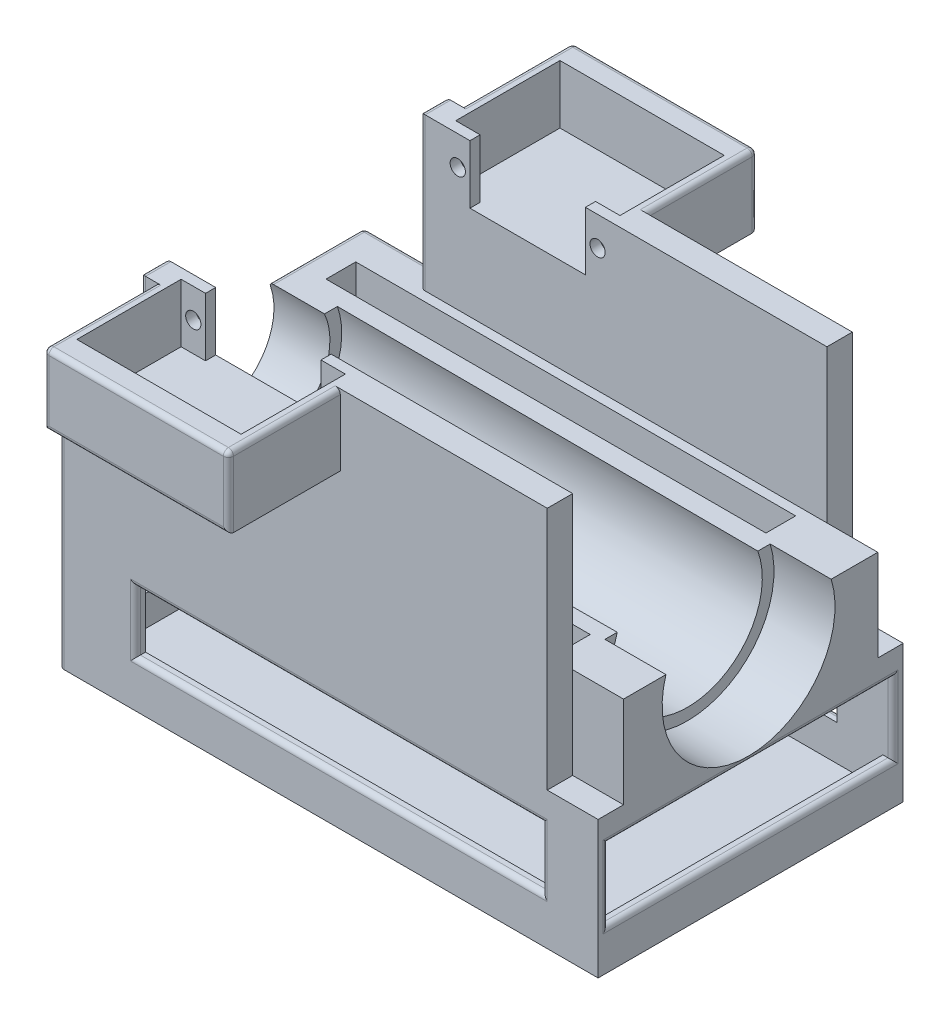
from build123d import *

# Parameters (mm, degrees)
SKETCH_1_W             = 106
SKETCH_1_H             = 60
ARDUINO_DEPTH          = 45
ARDUINO_2_DEPTH        = 102
SKETCH_3_W             = 28
SKETCH_3_H             = 6
ARDUINO_3_DEPTH        = 2
SKETCH_4_W             = 40
SKETCH_4_H             = 12
ARDUINO_4_DEPTH        = 60
ARDUINO_5_DEPTH        = 5
SKETCH_11_W            = 12
SKETCH_11_H            = 17
SKETCH_13_R            = 12.26
CUT_EXTRUDE_2679_DEPTH = 110.42948373
SKETCH_25_W            = 90
SKETCH_25_H            = 5
EXTRUDE_3075_DEPTH     = 30
EXTRUDE_3668_DEPTH     = 22
CUT_EXTRUDE_1_REACH    = 115.751
CUT_EXTRUDE_2_DEPTH    = 17.5
SKETCH_28_W            = 4.8
SKETCH_28_H            = 11.5
SKETCH_28_R            = 1.5
EXTRUDE_4845_DEPTH     = 2
FILLET_1_R             = 1
SKETCH_30_W            = 10
SKETCH_30_H            = 5
CUT_EXTRUDE_2_2_DEPTH  = 48
SKETCH_32_W            = 86.504453115
SKETCH_32_H            = 5.850542723
SKETCH_32_H_2          = 5.850542722
CUT_EXTRUDE_4_DEPTH    = 20


with BuildPart() as part:
    # 草图1 → arduino (new body)
    with BuildSketch(Plane(origin=(0, 0, 0), x_dir=(1, 0, 0), z_dir=(0, 1, 0))):
        with Locations((7.944608655, 0.410719743)):
            Rectangle(SKETCH_1_W, SKETCH_1_H)
    extrude(amount=ARDUINO_DEPTH)

    # 草图2 → arduino 2 (cut)
    with BuildSketch(Plane(origin=(60.944608655, 0, 0), x_dir=(0, 0, -1), z_dir=(1, 0, 0))):
        Polygon((-27.589280257, 22), (28.410719743, 22), (28.410719743, 2), (0.410719743, 2), (-27.589280257, 2), align=None)
    extrude(amount=-ARDUINO_2_DEPTH, mode=Mode.SUBTRACT)

    # 草图3 → arduino 3 (add)
    with BuildSketch(Plane(origin=(60.944608655, 0, 0), x_dir=(0, 0, -1), z_dir=(1, 0, 0))):
        with Locations((14.410719743, 5)):
            Rectangle(SKETCH_3_W, SKETCH_3_H)
        with Locations((-13.589280257, 5)):
            Rectangle(SKETCH_3_W, SKETCH_3_H)
    extrude(amount=-ARDUINO_3_DEPTH)

    # 草图4 → arduino 4 (cut)
    with BuildSketch(Plane(origin=(0, 0, -30.410719743), x_dir=(-1, 0, 0), z_dir=(0, 0, -1))):
        with Locations((10.055391345, 15)):
            Rectangle(SKETCH_4_W, SKETCH_4_H)
        with Locations((-29.944608655, 15)):
            Rectangle(SKETCH_4_W, SKETCH_4_H)
    extrude(amount=-ARDUINO_4_DEPTH, mode=Mode.SUBTRACT)

    # 草图7 → arduino 5 (cut)
    with BuildSketch(Plane.ZY.offset(45.055391345)):
        Polygon((-0.410719743, 22), (-28.410719743, 22), (-28.410719743, 8), (27.589280257, 8), (27.589280257, 22), align=None)
    extrude(amount=-ARDUINO_5_DEPTH, mode=Mode.SUBTRACT)

    # 草图11 → Cut-Revolve 2344 (revolve, cut)
    with BuildSketch(Plane.XY):
        with Locations((54.944608655, 31.5)):
            Rectangle(SKETCH_11_W, SKETCH_11_H)
    revolve(axis=Axis((60.944608655, 40, 0), (-1, 0, 0)), mode=Mode.SUBTRACT)

    # 草图12 → Cut-Revolve 2556 (revolve, cut)
    with BuildSketch(Plane.XY):
        Polygon((48.944608655, 25.3), (48.944608655, 40), (-34.055391345, 40), (-34.055391345, 25), align=None)
    revolve(axis=Axis((48.944608655, 40, 0), (-1, 0, 0)), mode=Mode.SUBTRACT)

    # 草图13 → Cut-Extrude 2679 (cut, through all)
    with BuildSketch(Plane(origin=(-34.055391345, 0, 0), x_dir=(0, 0, -1), z_dir=(1, 0, 0))):
        with Locations((0.410719743, 40)):
            Circle(SKETCH_13_R)
    extrude(amount=-CUT_EXTRUDE_2679_DEPTH, mode=Mode.SUBTRACT)

    # 草图25 → Extrude 3075 (add)
    with BuildSketch(Plane(origin=(0, 45, 0), x_dir=(1, 0, 0), z_dir=(0, 1, 0))):
        with Locations((15.944608655, -27.089280257)):
            Rectangle(SKETCH_25_W, SKETCH_25_H)
    extrude_3075 = extrude(amount=EXTRUDE_3075_DEPTH)

    # 草图26 → Extrude 3668 (add)
    with BuildSketch(Plane.XY.offset(29.589280257)):
        Polygon((10.244608655, 61), (10.244608655, 75), (8.244608655, 75), (8.244608655, 63.5), (-24.055391345, 63.5), (-24.055391345, 75), (-26.055391345, 75), (-26.055391345, 61), align=None)
        Polygon((8.244608655, 63.5), (8.244608655, 75), (-16.055391345, 75), (-24.055391345, 75), (-24.055391345, 63.5), align=None)
    extrude_3668 = extrude(amount=EXTRUDE_3668_DEPTH)

    # 草图26<3> → 舵机舱切除1 (cut, up to next)
    with BuildSketch(Plane.XY.offset(29.589280257), mode=Mode.PRIVATE) as cut_extrude_1_sk1:
        Polygon((8.244608655, 63.5), (8.244608655, 75), (-16.055391345, 75), (-24.055391345, 75), (-24.055391345, 63.5), align=None)
    cut_extrude_1_tool1 = extrude(cut_extrude_1_sk1.sketch, amount=-CUT_EXTRUDE_1_REACH, mode=Mode.PRIVATE) & part.part
    cut_extrude_1 = cut_extrude_1_tool1.solids().sort_by_distance((-7.905391, 69.25, 29.58928))[0]
    add(cut_extrude_1, mode=Mode.SUBTRACT)

    # 草图26<4> → Cut-Extrude 2 (cut)
    with BuildSketch(Plane.XY.offset(29.589280257)):
        Polygon((8.244608655, 63.5), (8.244608655, 75), (-16.055391345, 75), (-24.055391345, 75), (-24.055391345, 63.5), align=None)
    cut_extrude_2 = extrude(amount=CUT_EXTRUDE_2_DEPTH, mode=Mode.SUBTRACT)

    # 草图28 → Extrude 4845 (add)
    # profile 1 of 2: a face of its own
    with BuildSketch(Plane(origin=(0, 0, 24.589280257), x_dir=(-1, 0, 0), z_dir=(0, 0, -1))):
        with Locations((-5.844608655, 69.25)):
            Rectangle(SKETCH_28_W, SKETCH_28_H)
        with Locations((-5.844608655, 69.25)):
            Circle(SKETCH_28_R, mode=Mode.SUBTRACT)
    # profile 2 of 2: a face of its own
    with BuildSketch(Plane(origin=(0, 0, 24.589280257), x_dir=(-1, 0, 0), z_dir=(0, 0, -1))):
        with Locations((21.655391345, 69.25)):
            Rectangle(SKETCH_28_W, SKETCH_28_H)
        with Locations((21.655391345, 69.25)):
            Circle(SKETCH_28_R, mode=Mode.SUBTRACT)
    extrude_4845 = extrude(amount=-EXTRUDE_4845_DEPTH)

    # Mirror 4928: Extrude 3075, Extrude 3668, 舵机舱切除1, Cut-Extrude 2, Extrude 4845 across plane
    add(extrude_3075.mirror(Plane(origin=(0, 0, -0.410719743), x_dir=(1, 0, 0), z_dir=(0, 0, -1))))
    add(extrude_3668.mirror(Plane(origin=(0, 0, -0.410719743), x_dir=(1, 0, 0), z_dir=(0, 0, -1))))
    add(cut_extrude_1.mirror(Plane(origin=(0, 0, -0.410719743), x_dir=(1, 0, 0), z_dir=(0, 0, -1))), mode=Mode.SUBTRACT)
    add(cut_extrude_2.mirror(Plane(origin=(0, 0, -0.410719743), x_dir=(1, 0, 0), z_dir=(0, 0, -1))), mode=Mode.SUBTRACT)
    add(extrude_4845.mirror(Plane(origin=(0, 0, -0.410719743), x_dir=(1, 0, 0), z_dir=(0, 0, -1))))

    # 变化圆角1
    fillet_1_edges = [part.edges().sort_by_distance(p)[0] for p in [
        (-45.055391345, 45, 20.18632412),
        (-29.055391345, 60, 24.589280257),
        (-29.055391345, 60, 29.589280257),
        (-29.055391345, 75, 27.089280257),
        (10.244608655, 75, 40.589280257),
        (-26.055391345, 75, 40.589280257),
        (10.244608655, 68, 51.589280257),
        (-7.905391345, 75, 51.589280257),
        (-26.055391345, 68, 51.589280257),
        (-7.905391345, 61, 51.589280257),
        (60.944608655, 22, -0.410719743),
        (-37.055391345, 45, -30.410719743),
        (-29.055391345, 75, -27.910719743),
        (-29.055391345, 60, -30.410719743),
        (-29.055391345, 60, -25.410719743),
        (-7.905391345, 75, -52.410719743),
        (-26.055391345, 75, -41.410719743),
        (10.244608655, 75, -41.410719743),
        (-7.905391345, 61, -52.410719743),
        (-26.055391345, 68, -52.410719743),
        (-26.055391345, 61, -41.410719743),
        (10.244608655, 68, -52.410719743),
        (60.944608655, 15, 27.589280257),
        (60.944608655, 15, -28.410719743),
        (60.944608655, 8, -0.410719743),
        (-45.055391345, 45, -21.007763606),
        (-30.055391345, 15, -30.410719743),
        (9.944608655, 9, -30.410719743),
        (49.944608655, 15, 27.589280257),
        (9.944608655, 21, 29.589280257),
        (49.944608655, 15, 29.589280257),
        (-30.055391345, 15, 29.589280257),
        (9.944608655, 9, 29.589280257),
        (9.944608655, 21, -30.410719743),
        (49.944608655, 15, -30.410719743),
        (-45.055391345, 22.5, -30.410719743),
        (-45.055391345, 22.5, 29.589280257),
        (-45.055391345, 22, -0.410719743),
        (-37.055391345, 45, 29.589280257),
        (-45.055391345, 15, 27.589280257),
        (-45.055391345, 15, -28.410719743),
        (-45.055391345, 8, -0.410719743),
    ]]
    fillet(fillet_1_edges, radius=FILLET_1_R - 0.0001)  # a hair under: the kernel refuses the full size

    # 草图30 → Cut-Extrude 2 2 (cut)
    with BuildSketch(Plane(origin=(0, 75, 0), x_dir=(1, 0, 0), z_dir=(0, 1, 0))):
        with Locations((55.944608655, -27.089280257)):
            Rectangle(SKETCH_30_W, SKETCH_30_H)
        with Locations((55.944608655, 27.910719743)):
            Rectangle(SKETCH_30_W, SKETCH_30_H)
    extrude(amount=-CUT_EXTRUDE_2_2_DEPTH, mode=Mode.SUBTRACT)

    # 草图32 → 切除-拉伸4 (cut)
    with BuildSketch(Plane(origin=(0, 45, 0), x_dir=(1, 0, 0), z_dir=(0, 1, 0))):
        with Locations((3.4181604, 20.610413575)):
            Rectangle(SKETCH_32_W, SKETCH_32_H)
        with Locations((3.4181604, -19.788974089)):
            Rectangle(SKETCH_32_W, SKETCH_32_H_2)
    extrude(amount=-CUT_EXTRUDE_4_DEPTH, mode=Mode.SUBTRACT)


solid = part.part
